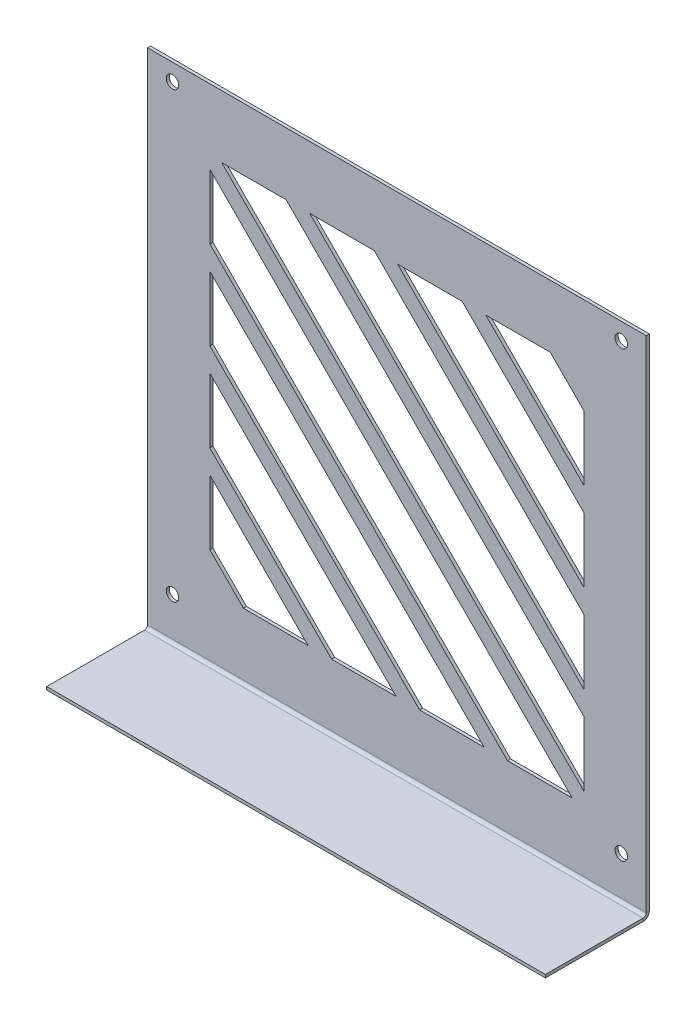
from build123d import *

# Parameters (mm, degrees)
SKETCH1_W          = 120
SKETCH1_H          = 120
BASE_FLANGE1_DEPTH = 0.7366
EDGE_FLANGE1_DEPTH = 120
SKETCH25_R         = 1.5
CUT_EXTRUDE1_DEPTH = 161.891420775
CUT_EXTRUDE2_DEPTH = 10


# Sheet-metal steps are written as plain solids
with BuildPart() as part:
    # Sketch1 → Base-Flange1 (new body)
    with BuildSketch(Plane.XY):
        Rectangle(SKETCH1_W, SKETCH1_H)
    extrude(amount=-BASE_FLANGE1_DEPTH)

    # Edge-Flange1 section (across the edge) → Edge-Flange1 (add)
    with BuildSketch(Plane(origin=(-60, -61, 0), x_dir=(0, 1, 0), z_dir=(1, 0, 0))):
        with BuildLine():
            Line((-0.7366, 0.7366), (-0.7366, 24.2634))
            Line((-0.7366, 24.2634), (0, 24.2634))
            Line((0, 24.2634), (0, 0.7366))
            ThreePointArc((0, 0.7366), (0.215745145, 0.215745145), (0.7366, 0))
            Line((0.7366, 0), (1, 0))
            Line((1, 0), (1, -0.7366))
            Line((1, -0.7366), (0.7366, -0.7366))
            ThreePointArc((0.7366, -0.7366), (-0.30510971, -0.30510971), (-0.7366, 0.7366))
        make_face()
    extrude(amount=EDGE_FLANGE1_DEPTH)

    # Sketch25 → Cut-Extrude1 (cut, through all)
    with BuildSketch(Plane(origin=(-46.34767359, -57.645882303, 26.3866), x_dir=(1, 0, 0), z_dir=(0, 0, 1))):
        with Locations((-7.65232641, 6.745882303)):
            Circle(SKETCH25_R)
        with Locations((100.34767359, 113.545882303)):
            Circle(SKETCH25_R)
        with Locations((100.34767359, 6.745882303)):
            Circle(SKETCH25_R)
        with Locations((-7.65232641, 113.545882303)):
            Circle(SKETCH25_R)
    extrude(amount=-CUT_EXTRUDE1_DEPTH, mode=Mode.SUBTRACT)

    # Sketch26 → Cut-Extrude2 (cut)
    with BuildSketch(Plane(origin=(0, 0, -0.7366), x_dir=(-1, 0, 0), z_dir=(0, 0, -1))):
        Polygon((45, -15.899963077), (45, -0.320923852), (0.188671673, -45.2634), (15.722249294, -45.2634), align=None)
        Polygon((21.370855866, -45.2634), (36.904433487, -45.2634), (45, -37.144140463), (45, -21.565101238), align=None)
        Polygon((-20.993512521, -45.2634), (-5.459934899, -45.2634), (45, 5.344214309), (45, 20.923253534), align=None)
        Polygon((-45, -26.851791695), (-45, -42.43083092), (42.175696714, 45), (26.642119093, 45), align=None)
        Polygon((-45, -5.607614309), (-45, -21.186653534), (20.993512521, 45), (5.459934899, 45), align=None)
        Polygon((-45, 15.636563077), (-45, 0.057523852), (-0.188671673, 45), (-15.722249294, 45), align=None)
        Polygon((-45, 36.880740463), (-45, 21.301701238), (-21.370855866, 45), (-36.904433487, 45), align=None)
        Polygon((45, 26.588391695), (45, 42.16743092), (-42.175696714, -45.2634), (-26.642119093, -45.2634), align=None)
    extrude(amount=-CUT_EXTRUDE2_DEPTH, mode=Mode.SUBTRACT)


solid = part.part
